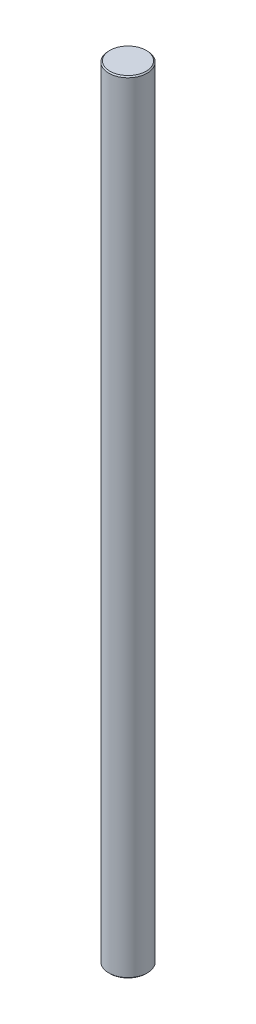
from build123d import *

# Parameters (mm, degrees)
SKETCH1_W     = 5
SKETCH1_H     = 203
CHAMFER1_SIZE = 0.3


with BuildPart() as part:
    # Sketch1 → Revolve1 (revolve)
    with BuildSketch(Plane.XY):
        with Locations((2.5, 0)):
            Rectangle(SKETCH1_W, SKETCH1_H)
    revolve(axis=Axis((0, 101.5, 0), (0, -1, 0)))

    # Chamfer1
    chamfer1_edges = [part.edges().sort_by_distance(p)[0] for p in [
        (-5, -101.5, 0),
        (-5, 101.5, 0),
    ]]
    chamfer(chamfer1_edges, length=CHAMFER1_SIZE)


solid = part.part
